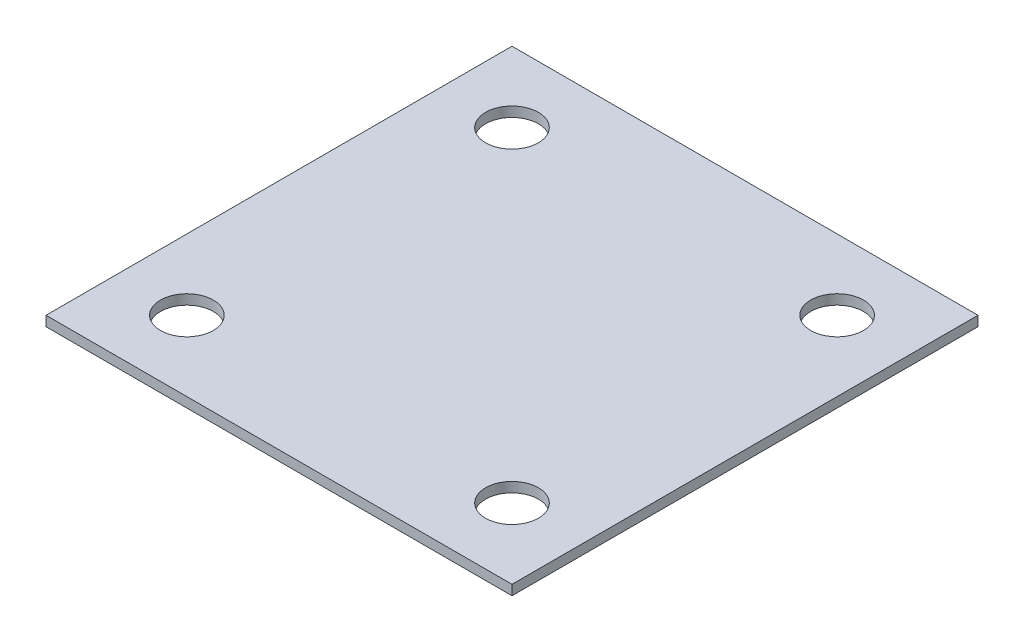
from build123d import *

# Parameters (mm, degrees)
SKETCH1_W           = 75
SKETCH1_H           = 75
SKETCH1_R           = 4.25
BOSS_EXTRUDE1_DEPTH = 1.6


with BuildPart() as part:
    # Sketch1 → Boss-Extrude1 (new body)
    with BuildSketch(Plane(origin=(0, 0, 0), x_dir=(1, 0, 0), z_dir=(0, 1, 0))):
        Rectangle(SKETCH1_W, SKETCH1_H)
        with Locations((-26.1629, -26.1629)):
            Circle(SKETCH1_R, mode=Mode.SUBTRACT)
        with Locations((26.163103615, -26.1629)):
            Circle(SKETCH1_R, mode=Mode.SUBTRACT)
        with Locations((-26.1629, 26.1629)):
            Circle(SKETCH1_R, mode=Mode.SUBTRACT)
        with Locations((26.163103615, 26.1629)):
            Circle(SKETCH1_R, mode=Mode.SUBTRACT)
    extrude(amount=BOSS_EXTRUDE1_DEPTH)


solid = part.part
